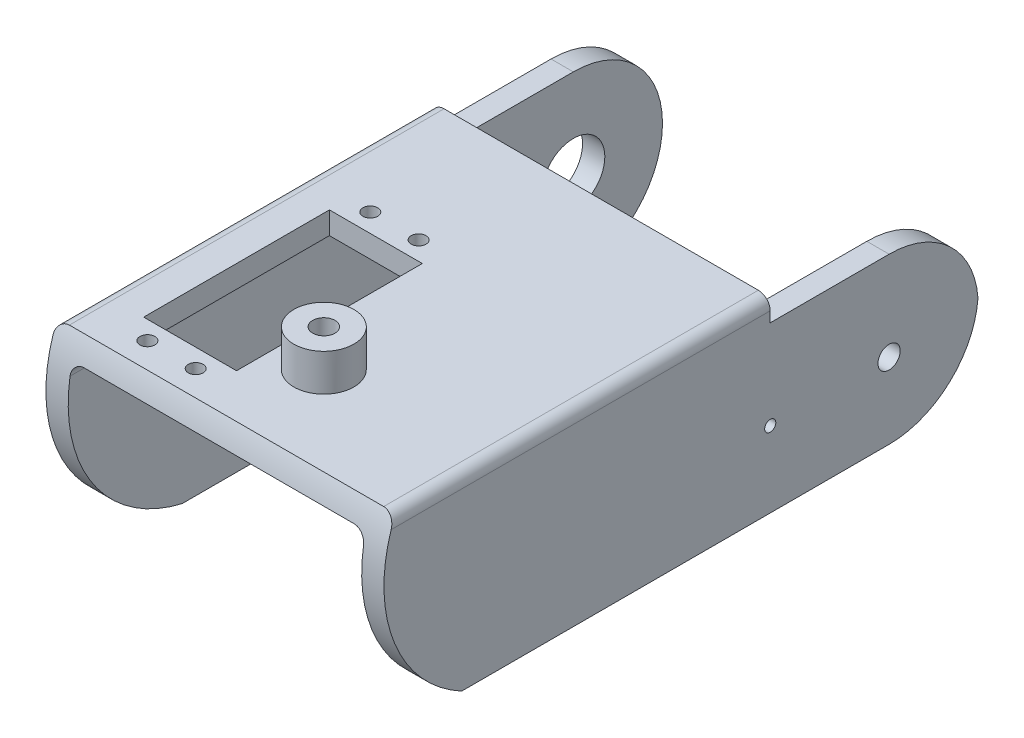
from build123d import *

# Parameters (mm, degrees)
BOSS_EXTRUDE1_DEPTH = 101.6
SKETCH2_W           = 4.7625
SKETCH2_H           = 38.1
SKETCH2_H_2         = 35.194001629
BOSS_EXTRUDE2_DEPTH = 44.45
FILLET1_R           = 19.05
FILLET4_R           = 2.54
FILLET5_R           = 2.54
SKETCH4_R           = 1.190625
CUT_EXTRUDE1_DEPTH  = 128.07291971
SKETCH5_R           = 1.5875
SKETCH5_W           = 19.84375
SKETCH5_H           = 39.6875
CUT_EXTRUDE2_DEPTH  = 117.05035969
SKETCH6_R           = 6.418083015
SKETCH6_R_2         = 2.38125
BOSS_EXTRUDE3_DEPTH = 7.9375
SKETCH7_R           = 2.38125
CUT_EXTRUDE3_DEPTH  = 117.05035969
CUT_EXTRUDE4_START  = -12.7
SKETCH8_R           = 1.190625
SKETCH8_R_2         = 2.38125
CUT_EXTRUDE4_DEPTH  = 12.7
CUT_EXTRUDE5_DEPTH  = 2.38125
SKETCH10_R          = 6.731
CUT_EXTRUDE6_DEPTH  = 127.239951738
CUT_EXTRUDE7_DEPTH  = 129.848153517


with BuildPart() as part:
    # Sketch1 → Boss-Extrude1 (new body)
    with BuildSketch(Plane.XY):
        Polygon((-36.065906398, 24.64981637), (36.165343602, 24.64981637), (36.165343602, -15.306685259), (31.402843602, -15.306685259), (31.402843602, 19.88731637), (-31.303406398, 19.88731637), (-31.303406398, -18.21268363), (-36.065906398, -18.21268363), align=None)
    extrude(amount=BOSS_EXTRUDE1_DEPTH)

    # Sketch2 → Boss-Extrude2 (add)
    with BuildSketch(Plane(origin=(0, 0, 0), x_dir=(-1, 0, 0), z_dir=(0, 0, -1))):
        with Locations((33.684656398, 0.83731637)):
            Rectangle(SKETCH2_W, SKETCH2_H)
        with Locations((-33.784093602, 2.290315555)):
            Rectangle(SKETCH2_W, SKETCH2_H_2)
    extrude(amount=BOSS_EXTRUDE2_DEPTH)

    # Fillet1
    # the kernel refuses this fillet: 19.05 mm, written as the material it takes off along each edge
    with BuildSketch(Plane(origin=(16.321593602, -18.21268363, -44.45), x_dir=(0, 0, 1), z_dir=(-1, 0, 0))) as fillet1_piece_1:
        with BuildLine():
            CenterArc((FILLET1_R, FILLET1_R), FILLET1_R, 180, 90)
            Line((0, FILLET1_R), (0, 0))
            Line((0, 0), (FILLET1_R, 0))
        make_face()
    extrude(amount=100.0125, mode=Mode.SUBTRACT)
    with BuildSketch(Plane(origin=(-83.690906398, 19.88731637, -44.45), x_dir=(0, -1, 0), z_dir=(1, 0, 0)), Plane(origin=(83.790343602, -15.306685259, -44.45), x_dir=(0, 1, 0), z_dir=(-1, 0, 0)), Plane(origin=(-16.222156398, 19.88731637, -44.45), x_dir=(0, -1, 0), z_dir=(1, 0, 0))) as fillet1_piece_2:
        with BuildLine():
            CenterArc((FILLET1_R, -FILLET1_R), FILLET1_R, 90, 90)
            Line((0, -FILLET1_R), (0, 0))
            Line((0, 0), (FILLET1_R, 0))
        make_face()
    extrude(amount=100.0125, mode=Mode.SUBTRACT)

    # Fillet4
    fillet4_edges = [part.edges().sort_by_distance(p)[0] for p in [
        (-36.065906398, 24.64981637, 50.8),
        (36.165343602, 24.64981637, 50.8),
        (31.402843602, 19.88731637, 50.8),
        (-31.303406398, 19.88731637, 50.8),
    ]]
    fillet(fillet4_edges, radius=FILLET4_R)

    # Fillet5
    fillet5_edges = [part.edges().sort_by_distance(p)[0] for p in [
        (33.784093602, -15.306685259, 101.6),
        (-33.684656398, -18.21268363, 101.6),
    ]]
    fillet(fillet5_edges, radius=FILLET5_R)

    # Sketch4 → Cut-Extrude1 (cut, through all)
    with BuildSketch(Plane.ZY.offset(36.065906398)):
        with Locations((-25.4, 0.83731637)):
            Circle(SKETCH4_R)
        with Locations((0, 0.83731637)):
            Circle(SKETCH4_R)
    extrude(amount=-CUT_EXTRUDE1_DEPTH, mode=Mode.SUBTRACT)

    # Sketch5 → Cut-Extrude2 (cut, through all)
    with BuildSketch(Plane(origin=(0, 24.64981637, 0), x_dir=(1, 0, 0), z_dir=(0, 1, 0))):
        with Locations(Location((-22.298893396, -26.9875, 0), (0, 0, 270))):
            Circle(SKETCH5_R)
        with Locations(Location((-11.980143396, -26.9875, 0), (0, 0, 180))):
            Circle(SKETCH5_R)
        with Locations(Location((-11.980143396, -74.6125, 0), (0, 0, 270))):
            Circle(SKETCH5_R)
        with Locations(Location((-22.298893396, -74.6125, 0), (0, 0, 180))):
            Circle(SKETCH5_R)
        with Locations((-17.139518396, -50.8)):
            Rectangle(SKETCH5_W, SKETCH5_H)
    extrude(amount=-CUT_EXTRUDE2_DEPTH, mode=Mode.SUBTRACT)

    # Sketch6 → Boss-Extrude3 (add)
    with BuildSketch(Plane(origin=(0, 24.64981637, 0), x_dir=(1, 0, 0), z_dir=(0, 1, 0))):
        with Locations(Location((1.910481604, -61.11875, 0), (0, 0, 90))):
            Circle(SKETCH6_R)
        with Locations(Location((1.910481604, -61.11875, 0), (0, 0, 270))):
            Circle(SKETCH6_R_2, mode=Mode.SUBTRACT)
    extrude(amount=BOSS_EXTRUDE3_DEPTH)

    # Sketch7 → Cut-Extrude3 (cut, through all)
    with BuildSketch(Plane(origin=(0, 24.64981637, 0), x_dir=(1, 0, 0), z_dir=(0, 1, 0))):
        with Locations(Location((1.910481604, -61.11875, 0), (0, 0, 180))):
            Circle(SKETCH7_R)
    extrude(amount=-CUT_EXTRUDE3_DEPTH, mode=Mode.SUBTRACT)

    # Sketch8 → Cut-Extrude4 (cut)
    with BuildSketch(Plane(origin=(36.165343602, 0, 0), x_dir=(0, 0, -1), z_dir=(1, 0, 0)).offset(CUT_EXTRUDE4_START)):
        with Locations(Location((0, 0.83731637, 0), (0, 0, 180))):
            Circle(SKETCH8_R)
        with Locations(Location((25.4, 0.83731637, 0), (0, 0, 90))):
            Circle(SKETCH8_R_2)
    extrude(amount=CUT_EXTRUDE4_DEPTH, mode=Mode.SUBTRACT)

    # Sketch9 → Cut-Extrude5 (cut)
    with BuildSketch(Plane.ZY.offset(36.065906398)):
        with BuildLine():
            Line((-25.069295566, 6.097430896), (0.016544331, 4.520279211))
            ThreePointArc((0.016544331, 4.520279211), (3.683, 0.83731637), (0.016544331, -2.84564647))
            Line((0.016544331, -2.84564647), (-25.069295566, -4.422798156))
            ThreePointArc((-25.069295566, -4.422798156), (-30.6705, 0.83731637), (-25.069295566, 6.097430896))
        make_face()
    extrude(amount=-CUT_EXTRUDE5_DEPTH, mode=Mode.SUBTRACT)

    # Sketch10 → Cut-Extrude6 (cut, through all)
    with BuildSketch(Plane(origin=(-31.303406398, 0, 0), x_dir=(0, 0, -1), z_dir=(1, 0, 0))):
        with Locations((25.4, 0.83731637)):
            Circle(SKETCH10_R)
    extrude(amount=-CUT_EXTRUDE6_DEPTH, mode=Mode.SUBTRACT)

    # Sketch11 → Cut-Extrude7 (cut, through all)
    with BuildSketch(Plane.ZY.offset(36.065906398)):
        with BuildLine():
            Line((78.230942549, 28.285686863), (107.145035189, 28.285686863))
            Line((107.145035189, 28.285686863), (107.145035189, -25.578978537))
            Line((107.145035189, -25.578978537), (47.434592149, -25.578978537))
            Line((47.434592149, -25.578978537), (47.434592149, -18.811963789))
            ThreePointArc((47.434592149, -18.811963789), (77.401439504, -4.789344682), (78.230942549, 28.285686863))
        make_face()
    extrude(amount=-CUT_EXTRUDE7_DEPTH, mode=Mode.SUBTRACT)


solid = part.part
